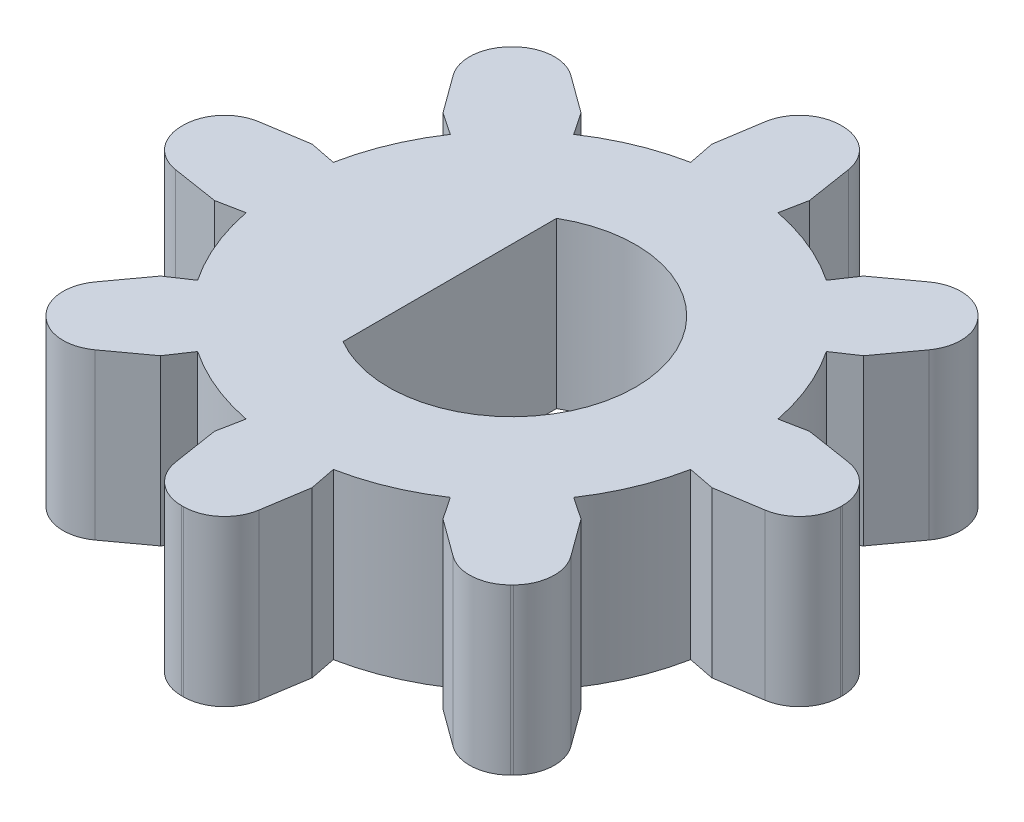
from build123d import *

# Parameters (mm, degrees)
SKETCH1_R           = 5.5
BOSS_EXTRUDE1_DEPTH = 4
BOSS_EXTRUDE4_DEPTH = 4
CHAMFER5_SIZE       = 2
CHAMFER5_SIZE2      = 0.69237056
CHAMFER6_SIZE       = 2
CHAMFER6_SIZE2      = 0.69237056
FILLET1_R           = 1
CIRPATTERN2_DEPTH   = 4


# Read off the part's stored shape, not the designer's step: CirPattern2
with BuildPart() as part:
    # Sketch1 → Boss-Extrude1 (new body)
    with BuildSketch(Plane(origin=(0, 0, 0), x_dir=(1, 0, 0), z_dir=(0, 1, 0))):
        with Locations(Location((0, 0, 0), (0, 0, 270))):
            Circle(SKETCH1_R)
        with BuildLine():
            Line((-1.51, -2.592276991), (-1.51, 2.592276991))
            ThreePointArc((-1.51, 2.592276991), (3, 0), (-1.51, -2.592276991))
        make_face(mode=Mode.SUBTRACT)
    extrude(amount=BOSS_EXTRUDE1_DEPTH)

    # Sketch2 → Boss-Extrude4 (add)
    with BuildSketch(Plane(origin=(0, 4, 0), x_dir=(1, 0, 0), z_dir=(0, 1, 0))):
        with BuildLine():
            Line((-4.906409736, 0.962882911), (-8, 1.57))
            Line((-8, 1.57), (-8, -1.57))
            Line((-8, -1.57), (-4.906409736, -0.962882911))
            ThreePointArc((-4.906409736, -0.962882911), (-5, 0), (-4.906409736, 0.962882911))
        make_face()
    extrude(amount=-BOSS_EXTRUDE4_DEPTH)

    # Chamfer5
    chamfer5_edges = [part.edges().sort_by_distance(p)[0] for p in [
        (-8, 2, -1.57),
    ]]
    chamfer5_side = [part.faces().sort_by_distance(p)[0] for p in [
        (-6.698525355, 2, -1.314585601),
    ]]
    chamfer(chamfer5_edges, length=CHAMFER5_SIZE, length2=CHAMFER5_SIZE2, reference=chamfer5_side[0])

    # Chamfer6
    chamfer6_edges = [part.edges().sort_by_distance(p)[0] for p in [
        (-8, 2, 1.57),
    ]]
    chamfer6_side = [part.faces().sort_by_distance(p)[0] for p in [
        (-6.698525355, 2, 1.314585601),
    ]]
    chamfer(chamfer6_edges, length=CHAMFER6_SIZE, length2=CHAMFER6_SIZE2, reference=chamfer6_side[0])

    # Fillet1
    fillet1_edges = [part.edges().sort_by_distance(p)[0] for p in [
        (-8, 2, -0.87762944),
        (-8, 2, 0.87762944),
    ]]
    fillet(fillet1_edges, radius=FILLET1_R)

    # CirPattern2 outline → CirPattern2 (add)
    with BuildSketch(Plane(origin=(0, 0, 0), x_dir=(1, 0, 0), z_dir=(0, 1, 0))):
        with BuildLine():
            ThreePointArc((-3.067344016, -4.565238295), (-3.889087297, -3.889087297), (-4.565238295, -3.067344016))
            Line((-4.565238295, -3.067344016), (-5.106925243, -3.431298779))
            Line((-5.106925243, -3.431298779), (-5.773253973, -4.344956726))
            ThreePointArc((-5.773253973, -4.344956726), (-5.962284465, -5.0117594), (-5.672403665, -5.641304834))
            Line((-5.672403665, -5.641304834), (-5.641304834, -5.672403665))
            ThreePointArc((-5.641304834, -5.672403665), (-5.0117594, -5.962284465), (-4.344956726, -5.773253973))
            Line((-4.344956726, -5.773253973), (-3.431298779, -5.106925243))
            Line((-3.431298779, -5.106925243), (-3.067344016, -4.565238295))
        make_face()
        with BuildLine():
            ThreePointArc((-4.565238295, 3.067344016), (-3.889087297, 3.889087297), (-3.067344016, 4.565238295))
            Line((-3.067344016, 4.565238295), (-3.431298779, 5.106925243))
            Line((-3.431298779, 5.106925243), (-4.344956726, 5.773253973))
            ThreePointArc((-4.344956726, 5.773253973), (-5.0117594, 5.962284465), (-5.641304834, 5.672403665))
            Line((-5.641304834, 5.672403665), (-5.672403665, 5.641304834))
            ThreePointArc((-5.672403665, 5.641304834), (-5.962284465, 5.0117594), (-5.773253973, 4.344956726))
            Line((-5.773253973, 4.344956726), (-5.106925243, 3.431298779))
            Line((-5.106925243, 3.431298779), (-4.565238295, 3.067344016))
        make_face()
        with BuildLine():
            ThreePointArc((-1.059171202, 5.39705071), (0, 5.5), (1.059171202, 5.39705071))
            Line((1.059171202, 5.39705071), (1.184846836, 6.037436105))
            Line((1.184846836, 6.037436105), (1.009958669, 7.154655399))
            ThreePointArc((1.009958669, 7.154655399), (0.672122719, 7.759820834), (0.021990194, 8))
            Line((0.021990194, 8), (-0.021990194, 8))
            ThreePointArc((-0.021990194, 8), (-0.672122719, 7.759820834), (-1.009958669, 7.154655399))
            Line((-1.009958669, 7.154655399), (-1.184846836, 6.037436105))
            Line((-1.184846836, 6.037436105), (-1.059171202, 5.39705071))
        make_face()
        with BuildLine():
            ThreePointArc((3.067344016, 4.565238295), (3.889087297, 3.889087297), (4.565238295, 3.067344016))
            Line((4.565238295, 3.067344016), (5.106925243, 3.431298779))
            Line((5.106925243, 3.431298779), (5.773253973, 4.344956726))
            ThreePointArc((5.773253973, 4.344956726), (5.962284465, 5.0117594), (5.672403665, 5.641304834))
            Line((5.672403665, 5.641304834), (5.641304834, 5.672403665))
            ThreePointArc((5.641304834, 5.672403665), (5.0117594, 5.962284465), (4.344956726, 5.773253973))
            Line((4.344956726, 5.773253973), (3.431298779, 5.106925243))
            Line((3.431298779, 5.106925243), (3.067344016, 4.565238295))
        make_face()
        with BuildLine():
            ThreePointArc((5.39705071, 1.059171202), (5.5, 0), (5.39705071, -1.059171202))
            Line((5.39705071, -1.059171202), (6.037436105, -1.184846836))
            Line((6.037436105, -1.184846836), (7.154655399, -1.009958669))
            ThreePointArc((7.154655399, -1.009958669), (7.759820834, -0.672122719), (8, -0.021990194))
            Line((8, -0.021990194), (8, 0.021990194))
            ThreePointArc((8, 0.021990194), (7.759820834, 0.672122719), (7.154655399, 1.009958669))
            Line((7.154655399, 1.009958669), (6.037436105, 1.184846836))
            Line((6.037436105, 1.184846836), (5.39705071, 1.059171202))
        make_face()
        with BuildLine():
            ThreePointArc((4.565238295, -3.067344016), (3.889087297, -3.889087297), (3.067344016, -4.565238295))
            Line((3.067344016, -4.565238295), (3.431298779, -5.106925243))
            Line((3.431298779, -5.106925243), (4.344956726, -5.773253973))
            ThreePointArc((4.344956726, -5.773253973), (5.0117594, -5.962284465), (5.641304834, -5.672403665))
            Line((5.641304834, -5.672403665), (5.672403665, -5.641304834))
            ThreePointArc((5.672403665, -5.641304834), (5.962284465, -5.0117594), (5.773253973, -4.344956726))
            Line((5.773253973, -4.344956726), (5.106925243, -3.431298779))
            Line((5.106925243, -3.431298779), (4.565238295, -3.067344016))
        make_face()
        with BuildLine():
            ThreePointArc((1.059171202, -5.39705071), (0, -5.5), (-1.059171202, -5.39705071))
            Line((-1.059171202, -5.39705071), (-1.184846836, -6.037436105))
            Line((-1.184846836, -6.037436105), (-1.009958669, -7.154655399))
            ThreePointArc((-1.009958669, -7.154655399), (-0.672122719, -7.759820834), (-0.021990194, -8))
            Line((-0.021990194, -8), (0.021990194, -8))
            ThreePointArc((0.021990194, -8), (0.672122719, -7.759820834), (1.009958669, -7.154655399))
            Line((1.009958669, -7.154655399), (1.184846836, -6.037436105))
            Line((1.184846836, -6.037436105), (1.059171202, -5.39705071))
        make_face()
    extrude(amount=CIRPATTERN2_DEPTH)


solid = part.part
